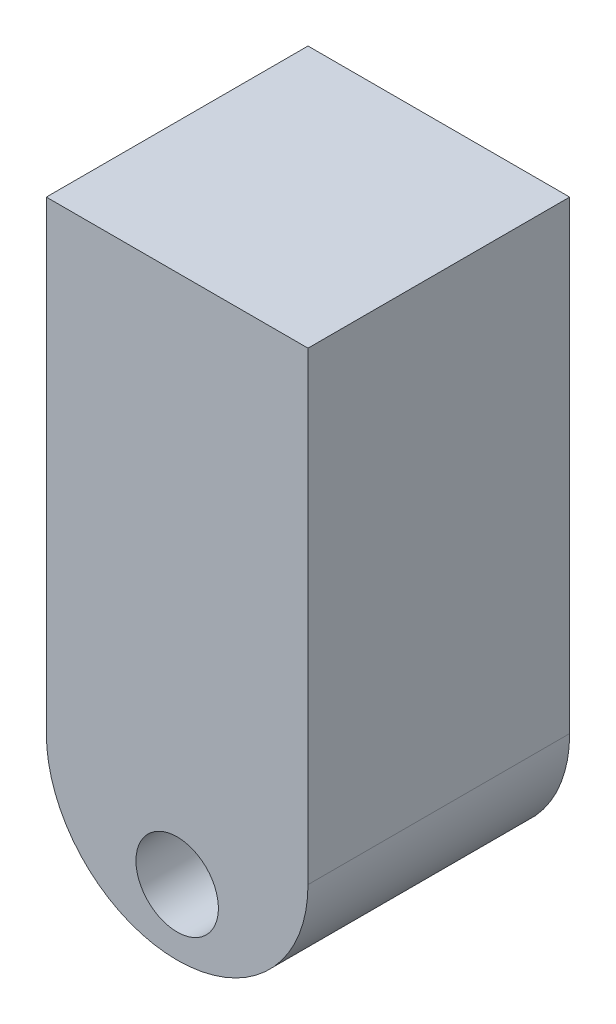
from build123d import *

# Parameters (mm, degrees)
SKETCH1_R           = 3
BOSS_EXTRUDE1_DEPTH = 19.05
SKETCH3_W           = 19.05
SKETCH3_H           = 19.05
BOSS_EXTRUDE2_DEPTH = 25.4


with BuildPart() as part:
    # Sketch1 → Boss-Extrude1 (new body)
    with BuildSketch(Plane.XY):
        with BuildLine():
            Line((-13.962302658, 14.995513055), (5.087697342, 14.995513055))
            Line((5.087697342, 14.995513055), (5.087697342, 6.570840919))
            ThreePointArc((5.087697342, 6.570840919), (-4.437302658, -2.954159081), (-13.962302658, 6.570840919))
            Line((-13.962302658, 6.570840919), (-13.962302658, 14.995513055))
        make_face()
        with Locations((-4.437302658, 1.820065848)):
            Circle(SKETCH1_R, mode=Mode.SUBTRACT)
    extrude(amount=BOSS_EXTRUDE1_DEPTH)

    # Sketch3 → Boss-Extrude2 (add)
    with BuildSketch(Plane(origin=(0, 14.995513055, 0), x_dir=(1, 0, 0), z_dir=(0, 1, 0))):
        with Locations((-4.437302658, -9.525)):
            Rectangle(SKETCH3_W, SKETCH3_H)
    extrude(amount=BOSS_EXTRUDE2_DEPTH)


solid = part.part
